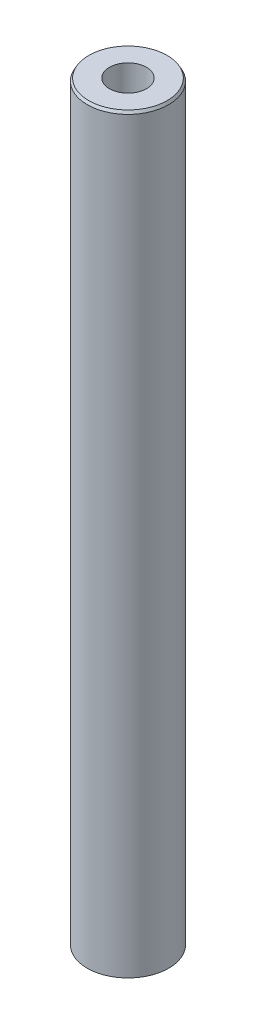
from build123d import *
from OCP.BRepFilletAPI import BRepFilletAPI_MakeChamfer

# Parameters (mm, degrees)
SKETCH1_R           = 32.5
BOSS_EXTRUDE1_DEPTH = 600
SKETCH2_R           = 14.802249082
CUT_EXTRUDE1_DEPTH  = 602.757841661
CHAMFER1_SIZE       = 2.182047602
CHAMFER1_SIZE2      = 1.239588744


with BuildPart() as part:
    # Sketch1 → Boss-Extrude1 (new body)
    with BuildSketch(Plane(origin=(0, 0, 0), x_dir=(1, 0, 0), z_dir=(0, 1, 0))):
        Circle(SKETCH1_R)
    extrude(amount=BOSS_EXTRUDE1_DEPTH)

    # Sketch2 → Cut-Extrude1 (cut, through all)
    with BuildSketch(Plane(origin=(0, 0, 0), x_dir=(1, 0, 0), z_dir=(0, 1, 0))):
        Circle(SKETCH2_R)
    extrude(amount=CUT_EXTRUDE1_DEPTH, mode=Mode.SUBTRACT)

    # Chamfer1: one chamfer whose edges measure the first distance from different faces: ONE call of the kernel's chamfer builder (chamfer() names one face for all edges)
    chamfer1_edges_1 = [part.edges().sort_by_distance(p)[0] for p in [
        (-32.5, 600, 0),
    ]]
    chamfer1_side_1 = [part.faces().sort_by_distance(p)[0] for p in [
        (-32.5, 300, 0),
    ]]
    chamfer1_edges_2 = [part.edges().sort_by_distance(p)[0] for p in [
        (-32.5, 0, 0),
    ]]
    chamfer1_side_2 = [part.faces().sort_by_distance(p)[0] for p in [
        (-31.580761184, 0, 0),
    ]]
    chamfer1 = BRepFilletAPI_MakeChamfer(part.part.solid().wrapped)
    for e in chamfer1_edges_1:
        chamfer1.Add(CHAMFER1_SIZE, CHAMFER1_SIZE2, e.wrapped, chamfer1_side_1[0].wrapped)  # the first distance lies on this face
    for e in chamfer1_edges_2:
        chamfer1.Add(CHAMFER1_SIZE, CHAMFER1_SIZE2, e.wrapped, chamfer1_side_2[0].wrapped)  # the first distance lies on this face
    add(Compound.cast(chamfer1.Shape()), mode=Mode.REPLACE)


solid = part.part
